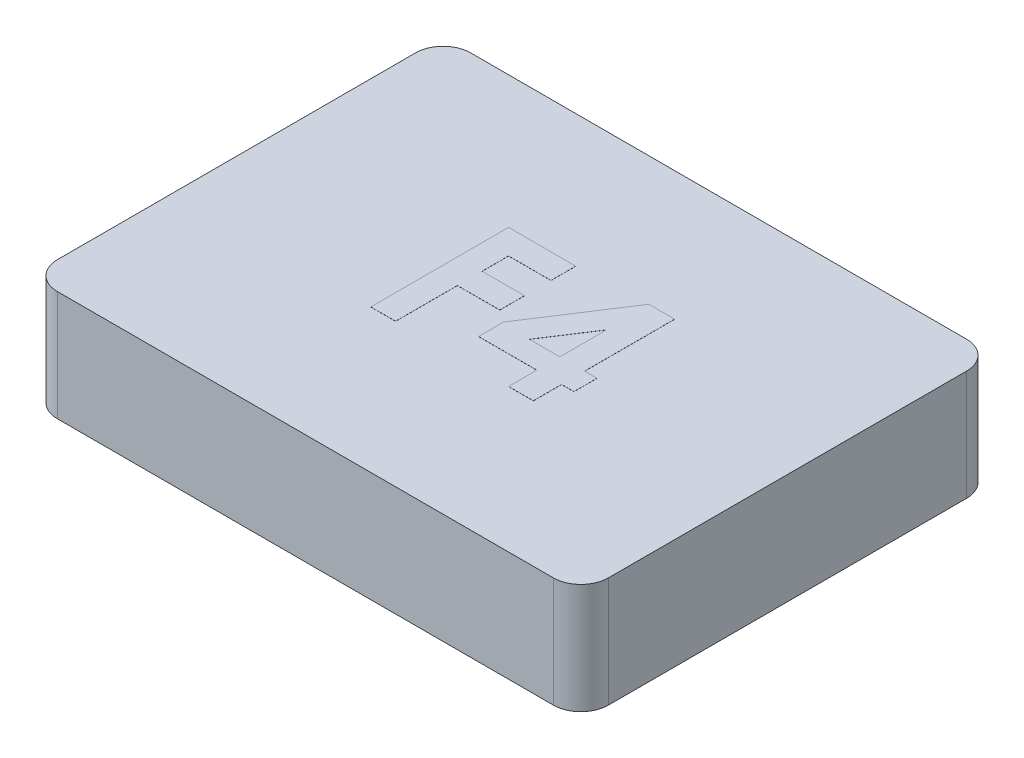
from build123d import *

# Parameters (mm, degrees)
SKETCH1_W           = 12.7
SKETCH1_H           = 9.525
BOSS_EXTRUDE1_DEPTH = 2.54
FILLET1_R           = 0.635
SHELL1_START        = 0.635
SHELL1_OUTLINE_W    = 1.905
SHELL1_OUTLINE_H    = 8.255
SHELL1_DEPTH        = 11.43
SKETCH2_R           = 2.54
BOSS_EXTRUDE2_DEPTH = 1.905
BOSS_EXTRUDE3_DEPTH = 0.00254


# Read off the part's stored shape, not the designer's step: Shell1
with BuildPart() as part:
    # Sketch1 → Boss-Extrude1 (new body)
    with BuildSketch(Plane(origin=(0, 0, 0), x_dir=(1, 0, 0), z_dir=(0, 1, 0))):
        with Locations((6.35, 4.7625)):
            Rectangle(SKETCH1_W, SKETCH1_H)
    extrude(amount=BOSS_EXTRUDE1_DEPTH)

    # Fillet1
    fillet1_edges = [part.edges().sort_by_distance(p)[0] for p in [
        (0, 1.27, -9.525),
        (12.7, 1.27, -9.525),
        (12.7, 1.27, 0),
        (0, 1.27, 0),
    ]]
    fillet(fillet1_edges, radius=FILLET1_R)

    # Shell1 outline → Shell1 (cut)
    with BuildSketch(Plane.YZ.offset(SHELL1_START)):
        with Locations((0.9525, -4.7625)):
            Rectangle(SHELL1_OUTLINE_W, SHELL1_OUTLINE_H)
    extrude(amount=SHELL1_DEPTH, mode=Mode.SUBTRACT)

    # Sketch2 → Boss-Extrude2 (add)
    with BuildSketch(Plane(origin=(0, 1.905, 0), x_dir=(-1, 0, 0), z_dir=(0, -1, 0))):
        with Locations(Location((-6.35, 4.7625, 0), (0, 0, 270))):
            Circle(SKETCH2_R)
    extrude(amount=BOSS_EXTRUDE2_DEPTH)

    # Sketch3 → Boss-Extrude3 (add)
    # profile 1 of 2: a face of its own
    with BuildSketch(Plane(origin=(0, 2.54, 0), x_dir=(1, 0, 0), z_dir=(0, 1, 0))):
        Polygon((4.557346154, 6.477), (6.104141026, 6.477), (6.104141026, 5.907128205), (5.127217949, 5.907128205), (5.127217949, 5.296551282), (6.104141026, 5.296551282), (6.104141026, 4.726679487), (5.127217949, 4.726679487), (5.127217949, 3.302), (4.557346154, 3.302), align=None)
    # profile 2 of 2: a face of its own
    with BuildSketch(Plane(origin=(0, 2.54, 0), x_dir=(1, 0, 0), z_dir=(0, 1, 0))):
        Polygon((7.708177484, 6.558410256), (8.302217949, 6.558410256), (8.302217949, 4.482448718), (8.587153846, 4.482448718), (8.587153846, 3.953282051), (8.302217949, 3.953282051), (8.302217949, 3.302), (7.732346154, 3.302), (7.732346154, 3.953282051), (6.389076923, 3.953282051), (6.389076923, 4.53015004), align=None)
        Polygon((7.732346154, 4.482448718), (7.732346154, 5.563042668), (7.029546675, 4.482448718), align=None, mode=Mode.SUBTRACT)
    extrude(amount=BOSS_EXTRUDE3_DEPTH)


solid = part.part
